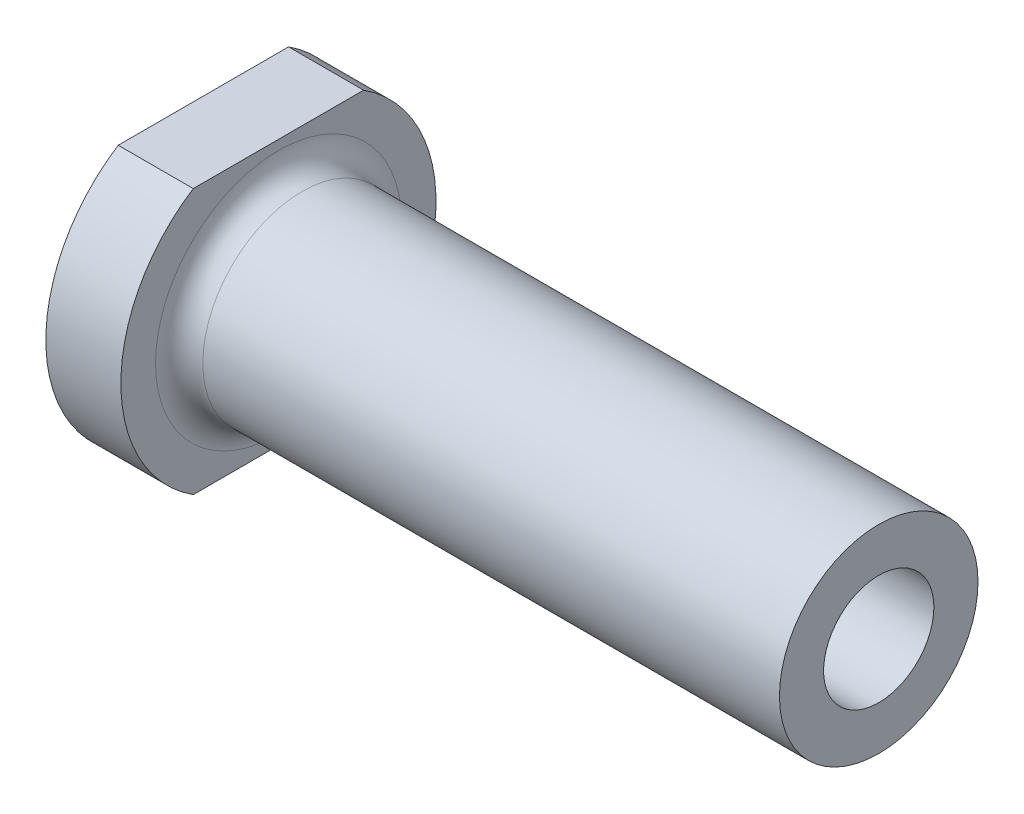
from build123d import *

# Parameters (mm, degrees)
FILLET1_R                            = 1.5
F_5_16_18_MAKE_SURE_TO_CHANGE_THIS_D = 7
CUT_EXTRUDE1_DEPTH                   = 46.135284466


with BuildPart() as part:
    # Sketch1 → Revolve1 (revolve)
    with BuildSketch(Plane.XY):
        Polygon((0, 0), (42.8625, 0), (42.8625, 6.299999973), (4.7625, 6.299999973), (4.7625, 9.999999939), (0, 9.999999939), align=None)
    revolve(axis=Axis((0, 0, 0), (-1, 0, 0)))

    # Fillet1
    fillet1_edges = [part.edges().sort_by_distance(p)[0] for p in [
        (4.7625, -6.299999973, 0),
    ]]
    fillet(fillet1_edges, radius=FILLET1_R)

    # 5/16-18 MAKE SURE TO CHANGE THIS (through all)
    with Locations(Plane(origin=(42.8625, 0, 0), x_dir=(0, 0, -1), z_dir=(1, 0, 0))):
        with Locations((0, 0)):
            Hole(F_5_16_18_MAKE_SURE_TO_CHANGE_THIS_D / 2)

    # Sketch4 → Cut-Extrude1 (cut, through all)
    with BuildSketch(Plane.ZY):
        with BuildLine():
            Line((-5.406463128, 8.412499939), (5.406463128, 8.412499939))
            ThreePointArc((5.406463128, 8.412499939), (0, 9.999999939), (-5.406463128, 8.412499939))
        make_face()
        with BuildLine():
            Line((5.406463128, -8.412499939), (-5.406463128, -8.412499939))
            ThreePointArc((-5.406463128, -8.412499939), (0, -9.999999939), (5.406463128, -8.412499939))
        make_face()
    extrude(amount=-CUT_EXTRUDE1_DEPTH, mode=Mode.SUBTRACT)


solid = part.part
